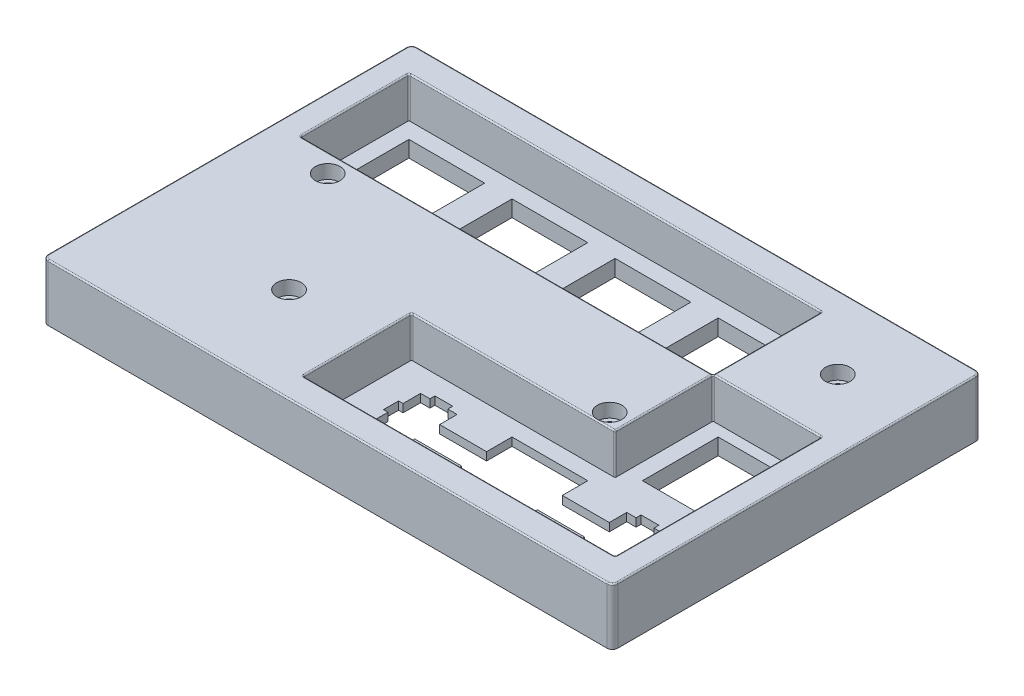
from build123d import *

# Parameters (mm, degrees)
SKETCH5_W           = 105.25
SKETCH5_H           = 68.15
SKETCH5_W_2         = 13.9993
SKETCH5_H_2         = 13.9994
SKETCH5_H_3         = 13.9993
SKETCH5_W_3         = 13.99955
BOSS_EXTRUDE1_DEPTH = 3
SKETCH6_W           = 52.0993
SKETCH6_H           = 19.04996
CUT_EXTRUDE1_DEPTH  = 1.5
SKETCH7_W           = 105.25
SKETCH7_H           = 68.15
SKETCH7_W_2         = 96.19935
SKETCH7_H_2         = 58.09946
BOSS_EXTRUDE2_DEPTH = 7.5
SKETCH9_R           = 1.5
CUT_EXTRUDE3_DEPTH  = 119.670818994
BOSS_EXTRUDE4_START = 7.5
SKETCH10_R          = 1.5
BOSS_EXTRUDE4_DEPTH = 7.5
SKETCH13_R          = 2.275
CUT_EXTRUDE5_DEPTH  = 2.55
FILLET1_R           = 0.25
FILLET2_R           = 1
FILLET3_R           = 0.25


with BuildPart() as part:
    # Sketch5 → Boss-Extrude1 (new body)
    with BuildSketch(Plane(origin=(0, 0, 0), x_dir=(1, 0, 0), z_dir=(0, 1, 0))):
        with Locations((47.7201423, 28.8325965)):
            Rectangle(SKETCH5_W, SKETCH5_H)
        Polygon((82.4438, 7.48273), (82.4438, 3.01377), (84.1692, 3.01377), (84.1692, 2.03261), (87.4695, 2.03261), (87.4695, 3.01377), (89.1949, 3.01377), (89.1949, 9.28384), (90.019, 9.28384), (90.019, 12.0826), (89.1949, 12.0826), (89.1949, 15.3128), (87.4695, 15.3128), (87.4695, 16.2333), (84.1692, 16.2333), (84.1692, 15.3128), (82.4438, 15.3128), (82.4438, 12.0826), (73.769, 12.0826), (73.769, 16.7831), (59.7697, 16.7831), (59.7697, 12.0826), (51.0949, 12.0826), (51.0949, 15.3128), (49.3695, 15.3128), (49.3695, 16.2333), (46.0692, 16.2333), (46.0692, 15.3128), (44.3438, 15.3128), (44.3438, 12.0826), (43.5197, 12.0826), (43.5197, 9.28384), (44.3438, 9.28384), (44.3438, 3.01377), (46.0692, 3.01377), (46.0692, 2.03261), (49.3695, 2.03261), (49.3695, 3.01377), (51.0949, 3.01377), (51.0949, 7.48273), (59.7697, 7.48273), (59.7697, 2.78364), (73.769, 2.78364), (73.769, 7.48273), align=None, mode=Mode.SUBTRACT)
        with Locations((85.81935, 28.8333)):
            Rectangle(SKETCH5_W_2, SKETCH5_H_2, mode=Mode.SUBTRACT)
        with Locations((66.76935, 47.88345)):
            Rectangle(SKETCH5_W_2, SKETCH5_H_3, mode=Mode.SUBTRACT)
        with Locations((47.71935, 47.88345)):
            Rectangle(SKETCH5_W_2, SKETCH5_H_3, mode=Mode.SUBTRACT)
        with Locations((28.66935, 47.88345)):
            Rectangle(SKETCH5_W_2, SKETCH5_H_3, mode=Mode.SUBTRACT)
        with Locations((9.619425, 47.88345)):
            Rectangle(SKETCH5_W_3, SKETCH5_H_3, mode=Mode.SUBTRACT)
    extrude(amount=BOSS_EXTRUDE1_DEPTH)

    # Sketch6 → Cut-Extrude1 (cut)
    with BuildSketch(Plane.XZ):
        with Locations((66.76935, -9.78337)):
            Rectangle(SKETCH6_W, SKETCH6_H)
    extrude(amount=-CUT_EXTRUDE1_DEPTH, mode=Mode.SUBTRACT)

    # Sketch7 → Boss-Extrude2 (add)
    with BuildSketch(Plane(origin=(0, 3, 0), x_dir=(1, 0, 0), z_dir=(0, 1, 0))):
        with Locations((47.7201423, 28.8325965)):
            Rectangle(SKETCH7_W, SKETCH7_H)
        with Locations((47.719325, 28.83337)):
            Rectangle(SKETCH7_W_2, SKETCH7_H_2, mode=Mode.SUBTRACT)
    extrude(amount=BOSS_EXTRUDE2_DEPTH)

    # Sketch9 → Cut-Extrude3 (cut, through all)
    with BuildSketch(Plane(origin=(0, 3, 0), x_dir=(1, 0, 0), z_dir=(0, 1, 0))):
        with Locations(Location((8.094425, 34.40845, 0), (0, 0, 270))):
            Circle(SKETCH9_R)
        with Locations(Location((23.094425, 12.25845, 0), (0, 0, 270))):
            Circle(SKETCH9_R)
        with Locations(Location((87.344425, 49.40845, 0), (0, 0, 270))):
            Circle(SKETCH9_R)
        with Locations(Location((72.344425, 22.25845, 0), (0, 0, 270))):
            Circle(SKETCH9_R)
    extrude(amount=-CUT_EXTRUDE3_DEPTH, mode=Mode.SUBTRACT)

    # Sketch10 → Boss-Extrude4 (add)
    with BuildSketch(Plane(origin=(0, 3, 0), x_dir=(1, 0, 0), z_dir=(0, 1, 0)).offset(BOSS_EXTRUDE4_START)):
        with BuildLine():
            Line((-0.38035, -0.21636), (-0.38035, 37.8838))
            Line((-0.38035, 37.8838), (75.5697, 37.8838))
            ThreePointArc((75.5697, 37.8838), (75.746476695, 37.957023305), (75.8197, 38.1338))
            Line((75.8197, 38.1338), (75.8197, 57.8831))
            Line((75.8197, 57.8831), (95.819, 57.8831))
            Line((95.819, 57.8831), (95.819, 37.8838))
            Line((95.819, 37.8838), (76.0697, 37.8838))
            ThreePointArc((76.0697, 37.8838), (75.892923305, 37.810576695), (75.8197, 37.6338))
            Line((75.8197, 37.6338), (75.8197, 19.7831))
            Line((75.8197, 19.7831), (38.19435, 19.7831))
            Line((38.19435, 19.7831), (38.19435, -0.21636))
            Line((38.19435, -0.21636), (-0.38035, -0.21636))
        make_face()
        with Locations(Location((87.344425, 49.40845, 0), (0, 0, 270))):
            Circle(SKETCH10_R, mode=Mode.SUBTRACT)
        with Locations(Location((72.344425, 22.25845, 0), (0, 0, 270))):
            Circle(SKETCH10_R, mode=Mode.SUBTRACT)
        with Locations(Location((8.094425, 34.40845, 0), (0, 0, 270))):
            Circle(SKETCH10_R, mode=Mode.SUBTRACT)
        with Locations(Location((23.094425, 12.25845, 0), (0, 0, 270))):
            Circle(SKETCH10_R, mode=Mode.SUBTRACT)
    extrude(amount=-BOSS_EXTRUDE4_DEPTH)

    # Sketch13 → Cut-Extrude5 (cut)
    with BuildSketch(Plane(origin=(0, 10.5, 0), x_dir=(1, 0, 0), z_dir=(0, 1, 0))):
        with Locations(Location((8.094425, 34.40845, 0), (0, 0, 270))):
            Circle(SKETCH13_R)
        with Locations(Location((23.094425, 12.25845, 0), (0, 0, 270))):
            Circle(SKETCH13_R)
        with Locations(Location((87.344425, 49.40845, 0), (0, 0, 270))):
            Circle(SKETCH13_R)
        with Locations(Location((72.344425, 22.25845, 0), (0, 0, 270))):
            Circle(SKETCH13_R)
    extrude(amount=-CUT_EXTRUDE5_DEPTH, mode=Mode.SUBTRACT)

    # Fillet1
    fillet1_edges = [part.edges().sort_by_distance(p)[0] for p in [
        (95.819, 6.75, 0.21636),
        (-0.38035, 6.75, -57.8831),
        (75.8197, 6.75, -57.8831),
        (95.819, 6.75, -37.8838),
        (75.8197, 6.75, -19.7831),
        (38.19435, 6.75, -19.7831),
        (38.19435, 6.75, 0.21636),
        (-0.38035, 6.75, -37.8838),
    ]]
    fillet(fillet1_edges, radius=FILLET1_R)

    # Fillet2
    fillet2_edges = [part.edges().sort_by_distance(p)[0] for p in [
        (-4.9048577, 5.25, -62.9075965),
        (100.3451423, 5.25, -62.9075965),
        (100.3451423, 5.25, 5.2424035),
        (-4.9048577, 5.25, 5.2424035),
    ]]
    fillet(fillet2_edges, radius=FILLET2_R)

    # Fillet3
    # the kernel refuses this fillet: 0.25 mm, written as the material it takes off along each edge
    with BuildSketch(Plane(origin=(75.5697, 10.5, -38.1338), x_dir=(0, 0, 1), z_dir=(-1, 0, 0))) as fillet3_piece_1:
        with BuildLine():
            CenterArc((0.25 + FILLET3_R, -FILLET3_R), FILLET3_R, 90, 90)
            Line((0.25, -FILLET3_R), (0.25, 0))
            Line((0.25, 0), (0.25 + FILLET3_R, 0))
        make_face()
    revolve(axis=Axis((75.5697, 10.5, -38.1338), (0, 1, 0)), revolution_arc=90, mode=Mode.SUBTRACT)
    with BuildSketch(Plane(origin=(-0.13035, 10.5, -37.8838), x_dir=(0, 0, 1), z_dir=(1, 0, 0))) as fillet3_piece_2:
        with BuildLine():
            CenterArc((FILLET3_R, FILLET3_R), FILLET3_R, 180, 90)
            Line((0, FILLET3_R), (0, 0))
            Line((0, 0), (FILLET3_R, 0))
        make_face()
    extrude(amount=75.70005, mode=Mode.SUBTRACT)
    with BuildSketch(Plane(origin=(76.0697, 10.5, -37.6338), x_dir=(0, 0, -1), z_dir=(1, 0, 0))) as fillet3_piece_3:
        with BuildLine():
            CenterArc((0.25 + FILLET3_R, -FILLET3_R), FILLET3_R, 90, 90)
            Line((0.25, -FILLET3_R), (0.25, 0))
            Line((0.25, 0), (0.25 + FILLET3_R, 0))
        make_face()
    revolve(axis=Axis((76.0697, 10.5, -37.6338), (0, 1, 0)), revolution_arc=90, mode=Mode.SUBTRACT)
    with BuildSketch(Plane(origin=(95.569, 10.5, -37.8838), x_dir=(0, 0, -1), z_dir=(-1, 0, 0)), Plane(origin=(75.8197, 10.5, -38.1338), x_dir=(1, 0, 0), z_dir=(0, 0, -1))) as fillet3_piece_4:
        with BuildLine():
            CenterArc((FILLET3_R, FILLET3_R), FILLET3_R, 180, 90)
            Line((0, FILLET3_R), (0, 0))
            Line((0, 0), (FILLET3_R, 0))
        make_face()
    extrude(amount=19.4993, mode=Mode.SUBTRACT)
    with BuildSketch(Plane(origin=(95.569, 10.5, 0.21636), x_dir=(0, 0, 1), z_dir=(-1, 0, 0))) as fillet3_piece_5:
        with BuildLine():
            CenterArc((FILLET3_R, -FILLET3_R), FILLET3_R, 90, 90)
            Line((0, -FILLET3_R), (0, 0))
            Line((0, 0), (FILLET3_R, 0))
        make_face()
    extrude(amount=57.12465, mode=Mode.SUBTRACT)
    with BuildSketch(Plane(origin=(95.819, 10.5, -37.6338), x_dir=(1, 0, 0), z_dir=(0, 0, 1))) as fillet3_piece_6:
        with BuildLine():
            CenterArc((FILLET3_R, -FILLET3_R), FILLET3_R, 90, 90)
            Line((0, -FILLET3_R), (0, 0))
            Line((0, 0), (FILLET3_R, 0))
        make_face()
    extrude(amount=37.60016, mode=Mode.SUBTRACT)
    with BuildSketch(Plane(origin=(38.19435, 10.5, -19.5331), x_dir=(-1, 0, 0), z_dir=(0, 0, 1))) as fillet3_piece_7:
        with BuildLine():
            CenterArc((FILLET3_R, FILLET3_R), FILLET3_R, 180, 90)
            Line((0, FILLET3_R), (0, 0))
            Line((0, 0), (FILLET3_R, 0))
        make_face()
    extrude(amount=19.49946, mode=Mode.SUBTRACT)
    with BuildSketch(Plane(origin=(75.5697, 10.5, -19.7831), x_dir=(0, 0, -1), z_dir=(-1, 0, 0))) as fillet3_piece_8:
        with BuildLine():
            CenterArc((FILLET3_R, FILLET3_R), FILLET3_R, 180, 90)
            Line((0, FILLET3_R), (0, 0))
            Line((0, 0), (FILLET3_R, 0))
        make_face()
    extrude(amount=37.12535, mode=Mode.SUBTRACT)
    with BuildSketch(Plane(origin=(75.8197, 10.5, -37.6338), x_dir=(-1, 0, 0), z_dir=(0, 0, 1))) as fillet3_piece_9:
        with BuildLine():
            CenterArc((FILLET3_R, FILLET3_R), FILLET3_R, 180, 90)
            Line((0, FILLET3_R), (0, 0))
            Line((0, 0), (FILLET3_R, 0))
        make_face()
    extrude(amount=17.6007, mode=Mode.SUBTRACT)
    with BuildSketch(Plane(origin=(-0.38035, 10.5, -38.1338), x_dir=(-1, 0, 0), z_dir=(0, 0, -1))) as fillet3_piece_10:
        with BuildLine():
            CenterArc((FILLET3_R, -FILLET3_R), FILLET3_R, 90, 90)
            Line((0, -FILLET3_R), (0, 0))
            Line((0, 0), (FILLET3_R, 0))
        make_face()
    extrude(amount=19.4993, mode=Mode.SUBTRACT)
    with BuildSketch(Plane(origin=(-0.13035, 10.5, -57.8831), x_dir=(0, 0, -1), z_dir=(1, 0, 0))) as fillet3_piece_11:
        with BuildLine():
            CenterArc((FILLET3_R, -FILLET3_R), FILLET3_R, 90, 90)
            Line((0, -FILLET3_R), (0, 0))
            Line((0, 0), (FILLET3_R, 0))
        make_face()
    extrude(amount=75.70005, mode=Mode.SUBTRACT)
    with BuildSketch(Plane(origin=(75.5697, 10.5, -20.0331), x_dir=(1, 0, 0), z_dir=(0, 0, -1))) as fillet3_piece_12:
        with BuildLine():
            CenterArc((0.25 - FILLET3_R, FILLET3_R), FILLET3_R, 270, 90)
            Line((0.25, FILLET3_R), (0.25, 0))
            Line((0.25, 0), (0.25 - FILLET3_R, 0))
        make_face()
    revolve(axis=Axis((75.5697, 10.5, -20.0331), (0, -1, 0)), revolution_arc=90, mode=Mode.SUBTRACT)
    with BuildSketch(Plane(origin=(95.569, 10.5, -0.03364), x_dir=(1, 0, 0), z_dir=(0, 0, -1))) as fillet3_piece_13:
        with BuildLine():
            CenterArc((0.25 + FILLET3_R, FILLET3_R), FILLET3_R, 180, 90)
            Line((0.25, FILLET3_R), (0.25, 0))
            Line((0.25, 0), (0.25 + FILLET3_R, 0))
        make_face()
    revolve(axis=Axis((95.569, 10.5, -0.03364), (0, -1, 0)), revolution_arc=90, mode=Mode.SUBTRACT)
    with BuildSketch(Plane(origin=(38.44435, 10.5, -0.03364), x_dir=(0, 0, 1), z_dir=(1, 0, 0))) as fillet3_piece_14:
        with BuildLine():
            CenterArc((0.25 + FILLET3_R, FILLET3_R), FILLET3_R, 180, 90)
            Line((0.25, FILLET3_R), (0.25, 0))
            Line((0.25, 0), (0.25 + FILLET3_R, 0))
        make_face()
    revolve(axis=Axis((38.44435, 10.5, -0.03364), (0, -1, 0)), revolution_arc=90, mode=Mode.SUBTRACT)
    with BuildSketch(Plane(origin=(38.44435, 10.5, -19.5331), x_dir=(-1, 0, 0), z_dir=(0, 0, 1))) as fillet3_piece_15:
        with BuildLine():
            CenterArc((0.25 + FILLET3_R, FILLET3_R), FILLET3_R, 180, 90)
            Line((0.25, FILLET3_R), (0.25, 0))
            Line((0.25, 0), (0.25 + FILLET3_R, 0))
        make_face()
    revolve(axis=Axis((38.44435, 10.5, -19.5331), (0, -1, 0)), revolution_arc=90, mode=Mode.SUBTRACT)
    with BuildSketch(Plane(origin=(95.569, 10.5, -37.6338), x_dir=(1, 0, 0), z_dir=(0, 0, 1))) as fillet3_piece_16:
        with BuildLine():
            CenterArc((0.25 + FILLET3_R, -FILLET3_R), FILLET3_R, 90, 90)
            Line((0.25, -FILLET3_R), (0.25, 0))
            Line((0.25, 0), (0.25 + FILLET3_R, 0))
        make_face()
    revolve(axis=Axis((95.569, 10.5, -37.6338), (0, 1, 0)), revolution_arc=90, mode=Mode.SUBTRACT)
    with BuildSketch(Plane(origin=(75.5697, 10.5, -57.6331), x_dir=(0, 0, -1), z_dir=(-1, 0, 0))) as fillet3_piece_17:
        with BuildLine():
            CenterArc((0.25 + FILLET3_R, FILLET3_R), FILLET3_R, 180, 90)
            Line((0.25, FILLET3_R), (0.25, 0))
            Line((0.25, 0), (0.25 + FILLET3_R, 0))
        make_face()
    revolve(axis=Axis((75.5697, 10.5, -57.6331), (0, -1, 0)), revolution_arc=90, mode=Mode.SUBTRACT)
    with BuildSketch(Plane(origin=(-0.13035, 10.5, -38.1338), x_dir=(-1, 0, 0), z_dir=(0, 0, -1))) as fillet3_piece_18:
        with BuildLine():
            CenterArc((0.25 + FILLET3_R, -FILLET3_R), FILLET3_R, 90, 90)
            Line((0.25, -FILLET3_R), (0.25, 0))
            Line((0.25, 0), (0.25 + FILLET3_R, 0))
        make_face()
    revolve(axis=Axis((-0.13035, 10.5, -38.1338), (0, 1, 0)), revolution_arc=90, mode=Mode.SUBTRACT)
    with BuildSketch(Plane(origin=(-0.13035, 10.5, -57.6331), x_dir=(0, 0, -1), z_dir=(1, 0, 0))) as fillet3_piece_19:
        with BuildLine():
            CenterArc((0.25 + FILLET3_R, -FILLET3_R), FILLET3_R, 90, 90)
            Line((0.25, -FILLET3_R), (0.25, 0))
            Line((0.25, 0), (0.25 + FILLET3_R, 0))
        make_face()
    revolve(axis=Axis((-0.13035, 10.5, -57.6331), (0, 1, 0)), revolution_arc=90, mode=Mode.SUBTRACT)
    with BuildSketch(Plane(origin=(99.3451423, 10.5, -62.9075965), x_dir=(0, 0, 1), z_dir=(-1, 0, 0)), Plane(origin=(-3.9048577, 10.5, 5.2424035), x_dir=(0, 0, -1), z_dir=(1, 0, 0))) as fillet3_piece_20:
        with BuildLine():
            CenterArc((FILLET3_R, -FILLET3_R), FILLET3_R, 90, 90)
            Line((0, -FILLET3_R), (0, 0))
            Line((0, 0), (FILLET3_R, 0))
        make_face()
    extrude(amount=103.25, mode=Mode.SUBTRACT)
    with BuildSketch(Plane(origin=(100.3451423, 10.5, 4.2424035), x_dir=(-1, 0, 0), z_dir=(0, 0, -1)), Plane(origin=(-4.9048577, 10.5, -61.9075965), x_dir=(1, 0, 0), z_dir=(0, 0, 1))) as fillet3_piece_21:
        with BuildLine():
            CenterArc((FILLET3_R, -FILLET3_R), FILLET3_R, 90, 90)
            Line((0, -FILLET3_R), (0, 0))
            Line((0, 0), (FILLET3_R, 0))
        make_face()
    extrude(amount=66.15, mode=Mode.SUBTRACT)
    with BuildSketch(Plane(origin=(-3.9048577, 10.5, -61.9075965), x_dir=(0, 0, -1), z_dir=(1, 0, 0))) as fillet3_piece_22:
        with BuildLine():
            CenterArc((1 - FILLET3_R, -FILLET3_R), FILLET3_R, 0, 90)
            Line((1, -FILLET3_R), (1, 0))
            Line((1, 0), (1 - FILLET3_R, 0))
        make_face()
    revolve(axis=Axis((-3.9048577, 10.5, -61.9075965), (0, 1, 0)), revolution_arc=90, mode=Mode.SUBTRACT)
    with BuildSketch(Plane(origin=(-3.9048577, 10.5, 4.2424035), x_dir=(0, 0, 1), z_dir=(1, 0, 0))) as fillet3_piece_23:
        with BuildLine():
            CenterArc((1 - FILLET3_R, FILLET3_R), FILLET3_R, 270, 90)
            Line((1, FILLET3_R), (1, 0))
            Line((1, 0), (1 - FILLET3_R, 0))
        make_face()
    revolve(axis=Axis((-3.9048577, 10.5, 4.2424035), (0, -1, 0)), revolution_arc=90, mode=Mode.SUBTRACT)
    with BuildSketch(Plane(origin=(99.3451423, 10.5, 4.2424035), x_dir=(1, 0, 0), z_dir=(0, 0, -1))) as fillet3_piece_24:
        with BuildLine():
            CenterArc((1 - FILLET3_R, FILLET3_R), FILLET3_R, 270, 90)
            Line((1, FILLET3_R), (1, 0))
            Line((1, 0), (1 - FILLET3_R, 0))
        make_face()
    revolve(axis=Axis((99.3451423, 10.5, 4.2424035), (0, -1, 0)), revolution_arc=90, mode=Mode.SUBTRACT)
    with BuildSketch(Plane(origin=(99.3451423, 10.5, -61.9075965), x_dir=(1, 0, 0), z_dir=(0, 0, 1))) as fillet3_piece_25:
        with BuildLine():
            CenterArc((1 - FILLET3_R, -FILLET3_R), FILLET3_R, 0, 90)
            Line((1, -FILLET3_R), (1, 0))
            Line((1, 0), (1 - FILLET3_R, 0))
        make_face()
    revolve(axis=Axis((99.3451423, 10.5, -61.9075965), (0, 1, 0)), revolution_arc=90, mode=Mode.SUBTRACT)


solid = part.part
